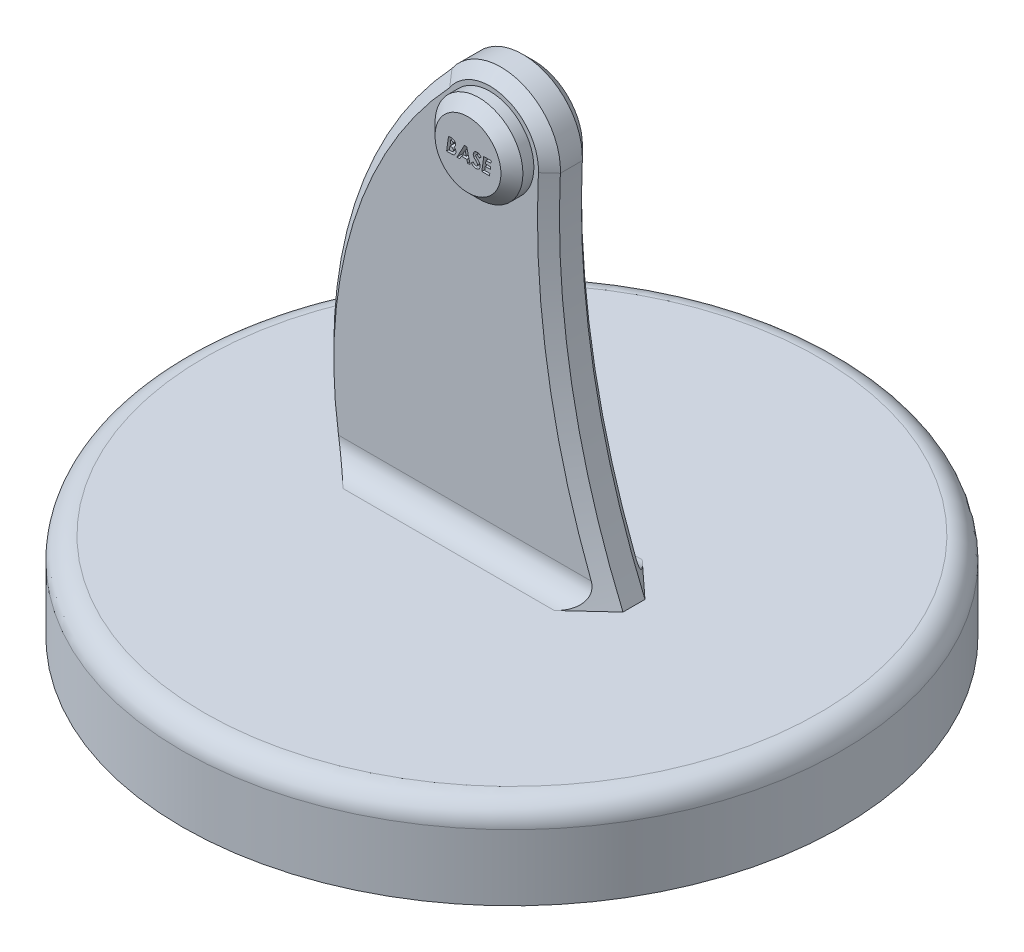
from build123d import *

# Parameters (mm, degrees)
SKETCH1_R           = 75
BOSS_EXTRUDE1_DEPTH = 20
FILLET1_R           = 5
BOSS_EXTRUDE2_DEPTH = 5
CHAMFER1_SIZE       = 2.5
FILLET2_R           = 5
SKETCH3_R           = 10
BOSS_EXTRUDE4_DEPTH = 5
CHAMFER2_SIZE       = 2.5
SKETCH4_R           = 5
CUT_EXTRUDE1_DEPTH  = 10
CUT_EXTRUDE2_DEPTH  = 2.5


with BuildPart() as part:
    # Sketch1 → Boss-Extrude1 (new body)
    with BuildSketch(Plane(origin=(0, 0, 0), x_dir=(1, 0, 0), z_dir=(0, 1, 0))):
        with Locations(Location((0, 0, 0), (0, 0, 270))):
            Circle(SKETCH1_R)
    extrude(amount=BOSS_EXTRUDE1_DEPTH)

    # Fillet1
    fillet1_edges = [part.edges().sort_by_distance(p)[0] for p in [
        (0, 20, -75),
    ]]
    fillet(fillet1_edges, radius=FILLET1_R)

    # Sketch2 → Boss-Extrude2 (add, symmetric)
    with BuildSketch(Plane.XY):
        with BuildLine():
            Line((-35, 15), (30, 15))
            ThreePointArc((30, 15), (16.650621757, 56.17656303), (13.517551249, 99.349460913))
            ThreePointArc((13.517551249, 99.349460913), (4.342920171, 112.817427092), (-11.128856203, 107.700386515))
            ThreePointArc((-11.128856203, 107.700386515), (-34.877004307, 64.392032842), (-35, 15))
        make_face()
    extrude(amount=BOSS_EXTRUDE2_DEPTH, both=True)

    # Chamfer1
    chamfer1_edges = [part.edges().sort_by_distance(p)[0] for p in [
        (-34.206168084, 66.865449042, 5),
    ]]
    chamfer(chamfer1_edges, length=CHAMFER1_SIZE)
    chamfer1_2_edges = [part.edges().sort_by_distance(p)[0] for p in [
        (-34.206168084, 66.865449042, -5),
    ]]
    chamfer(chamfer1_2_edges, length=CHAMFER1_SIZE)
    chamfer1_3_edges = [part.edges().sort_by_distance(p)[0] for p in [
        (4.342920171, 112.817427092, 5),
        (16.146226739, 58.866294053, 5),
    ]]
    chamfer(chamfer1_3_edges, length=CHAMFER1_SIZE - 0.0001)  # a hair under: the kernel refuses the full size
    chamfer1_4_edges = [part.edges().sort_by_distance(p)[0] for p in [
        (16.146226739, 58.866294053, -5),
        (4.342920171, 112.817427092, -5),
    ]]
    chamfer(chamfer1_4_edges, length=CHAMFER1_SIZE - 0.0001)  # a hair under: the kernel refuses the full size

    # Fillet2
    fillet2_edges = [part.edges().sort_by_distance(p)[0] for p in [
        (-4.258213904, 20, -5),
        (-4.258213904, 20, 5),
    ]]
    fillet(fillet2_edges, radius=FILLET2_R)

    # Sketch3 → Boss-Extrude4 (add, symmetric)
    with BuildSketch(Plane.XY.offset(5)):
        with Locations((0, 100)):
            Circle(SKETCH3_R)
    extrude(amount=BOSS_EXTRUDE4_DEPTH, both=True)

    # Chamfer2
    chamfer2_edges = [part.edges().sort_by_distance(p)[0] for p in [
        (-10, 100, 10),
    ]]
    chamfer(chamfer2_edges, length=CHAMFER2_SIZE)

    # Sketch4 → Cut-Extrude1 (cut)
    with BuildSketch(Plane(origin=(0, 0, -5), x_dir=(-1, 0, 0), z_dir=(0, 0, -1))):
        with Locations((0, 100)):
            Circle(SKETCH4_R)
    extrude(amount=-CUT_EXTRUDE1_DEPTH, mode=Mode.SUBTRACT)

    # Sketch5 → Cut-Extrude2 (cut)
    # profile 1 of 4: a face of its own
    with BuildSketch(Plane.XY.offset(10)):
        with BuildLine():
            Line((-4.422917007, 101.448421654), (-3.947175821, 101.448421654))
            add(Edge.make_bspline(
                [(-3.947175821, 101.448421654), (-3.912187022, 101.448314109), (-3.844500379, 101.448106062), (-3.746513184, 101.442654237), (-3.655317716, 101.435046502), (-3.57090309, 101.425566301), (-3.493737475, 101.411226731), (-3.423343143, 101.394935777), (-3.359804192, 101.375644939), (-3.28516824, 101.344965748), (-3.20087624, 101.298193388), (-3.108817155, 101.229869759), (-3.029332764, 101.145607546), (-2.959690254, 101.050994123), (-2.903079777, 100.947362768), (-2.86295903, 100.837570678), (-2.837650581, 100.723872075), (-2.834472541, 100.646533318), (-2.832872936, 100.60760635)],
                knots=[0, 0, 0, 0, 1.060182399, 2.050947427, 2.972933909, 3.833603532, 4.623758792, 5.349968742, 6.022619805, 6.633490032, 7.792338899, 8.934684725, 10.0933911, 11.288487101, 12.487324871, 13.658169267, 14.821284765, 16, 16, 16, 16], degree=3))
            add(Edge.make_bspline(
                [(-2.832872936, 100.60760635), (-2.834061487, 100.574898056), (-2.836414088, 100.510155724), (-2.852577757, 100.414389493), (-2.88032245, 100.321675968), (-2.918146006, 100.232291442), (-2.966597737, 100.148111354), (-3.02494751, 100.070443375), (-3.093240264, 99.999984284), (-3.145075528, 99.959554704), (-3.171234314, 99.939151822)],
                knots=[0, 0, 0, 0, 1.008802286, 1.996808917, 2.985853824, 3.987935791, 4.984003692, 5.974085787, 6.977617699, 8, 8, 8, 8], degree=3))
            add(Edge.make_bspline(
                [(-3.171234314, 99.939151822), (-3.137746271, 99.914256427), (-3.072344036, 99.865635656), (-2.986839677, 99.781511231), (-2.914285714, 99.691887444), (-2.854062269, 99.596364402), (-2.808396679, 99.493802096), (-2.775087675, 99.385602233), (-2.754772417, 99.27124769), (-2.752580946, 99.192975084), (-2.75146268, 99.153034034)],
                knots=[0, 0, 0, 0, 1.076867414, 2.103124847, 3.088410714, 4.050300241, 5.011160291, 5.979497965, 6.968975523, 8, 8, 8, 8], degree=3))
            add(Edge.make_bspline(
                [(-2.75146268, 99.153034034), (-2.753022081, 99.111358505), (-2.75610573, 99.028946918), (-2.78163704, 98.908199391), (-2.824110819, 98.793066125), (-2.882713192, 98.685429847), (-2.952228658, 98.586861786), (-3.03194489, 98.501424114), (-3.118937178, 98.4294262), (-3.198630022, 98.380412809), (-3.268059951, 98.34916751), (-3.325539045, 98.3289474), (-3.388421631, 98.311605401), (-3.456960206, 98.298201306), (-3.530710684, 98.286299685), (-3.609989957, 98.279360824), (-3.694595453, 98.273699026), (-3.752967136, 98.273516055), (-3.783083273, 98.273421654)],
                knots=[0, 0, 0, 0, 1.303747164, 2.57810456, 3.844347155, 5.133141427, 6.403898642, 7.610790585, 8.780141826, 9.92981316, 10.526901919, 11.160883678, 11.835562906, 12.567100275, 13.346228134, 14.173084326, 15.057425816, 16, 16, 16, 16], degree=3))
            Line((-3.783083273, 98.273421654), (-4.868129346, 98.273421654))
            Line((-4.868129346, 98.273421654), (-4.422917007, 101.448421654))
        make_face()
        with BuildLine():
            Line((-4.026042007, 100.18656268), (-3.921735116, 100.18656268))
            add(Edge.make_bspline(
                [(-3.921735116, 100.18656268), (-3.902863091, 100.186646522), (-3.866804712, 100.186806719), (-3.815299626, 100.189042871), (-3.768354898, 100.19103224), (-3.726416644, 100.195785211), (-3.688778539, 100.20058886), (-3.656178629, 100.207107156), (-3.627759333, 100.213413668), (-3.59685583, 100.225919719), (-3.561623527, 100.244541808), (-3.524553228, 100.276312739), (-3.489948085, 100.314526829), (-3.459873099, 100.360342813), (-3.434574978, 100.411290795), (-3.416144779, 100.466041468), (-3.404967425, 100.523625225), (-3.403495142, 100.562822908), (-3.402744731, 100.582801662)],
                knots=[0, 0, 0, 0, 1.199333927, 2.291542006, 3.276678834, 4.184405191, 4.973343612, 5.686872737, 6.298011521, 6.818495195, 7.801417815, 8.815884106, 9.903594398, 11.069613373, 12.286904311, 13.509850177, 14.730790054, 16, 16, 16, 16], degree=3))
            add(Edge.make_bspline(
                [(-3.402744731, 100.582801662), (-3.403340166, 100.601073495), (-3.404504993, 100.636817941), (-3.413979372, 100.68827061), (-3.430208995, 100.735778086), (-3.452362404, 100.778805354), (-3.479417937, 100.816881747), (-3.510924838, 100.848950164), (-3.547254247, 100.873263021), (-3.58106286, 100.88860861), (-3.612118196, 100.8978148), (-3.640930753, 100.903171559), (-3.674868651, 100.908273683), (-3.714101556, 100.912714115), (-3.758662065, 100.915803711), (-3.808513938, 100.917489622), (-3.86363906, 100.918800709), (-3.902229685, 100.919099198), (-3.922371133, 100.919254987)],
                knots=[0, 0, 0, 0, 1.217888189, 2.382505203, 3.473394342, 4.554621668, 5.598222957, 6.577909812, 7.534682879, 8.496456537, 9.042175867, 9.690967717, 10.448749248, 11.330850431, 12.323004962, 13.426554395, 14.656852007, 16, 16, 16, 16], degree=3))
            Line((-3.922371133, 100.919254987), (-4.026042007, 100.18656268))
        make_face(mode=Mode.SUBTRACT)
        with BuildLine():
            Line((-4.218755348, 98.802588321), (-3.851137159, 98.789867968))
            add(Edge.make_bspline(
                [(-3.851137159, 98.789867968), (-3.82886567, 98.79025255), (-3.78574682, 98.790997123), (-3.723315517, 98.796183613), (-3.665435358, 98.8040994), (-3.612339904, 98.815960111), (-3.564491395, 98.832243728), (-3.520696569, 98.850370279), (-3.481590307, 98.87253393), (-3.447577082, 98.899142641), (-3.417838312, 98.928265175), (-3.391758536, 98.959890201), (-3.370428688, 98.994304849), (-3.352132652, 99.031021529), (-3.338488319, 99.070414951), (-3.327934249, 99.112276404), (-3.322454789, 99.156702846), (-3.321712196, 99.187154251), (-3.321334475, 99.202643409)],
                knots=[0, 0, 0, 0, 1.396545255, 2.703789819, 3.925918336, 5.057947269, 6.109009747, 7.09185152, 8.026860065, 8.917724649, 9.79206713, 10.633022212, 11.481406092, 12.325717456, 13.200363125, 14.090334412, 15.028645384, 16, 16, 16, 16], degree=3))
            add(Edge.make_bspline(
                [(-3.321334475, 99.202643409), (-3.322385227, 99.225603265), (-3.32443892, 99.27047827), (-3.338513498, 99.336242471), (-3.363955735, 99.397469361), (-3.397553605, 99.454808895), (-3.439098572, 99.506191038), (-3.488488995, 99.549593109), (-3.544149116, 99.584640288), (-3.596080667, 99.607277932), (-3.643311872, 99.621816482), (-3.686913344, 99.62996578), (-3.737495192, 99.638637122), (-3.795762383, 99.644308599), (-3.861003829, 99.650476727), (-3.933794729, 99.653850498), (-4.013939073, 99.656492633), (-4.069924495, 99.657085936), (-4.099184034, 99.657396013)],
                knots=[0, 0, 0, 0, 1.072622611, 2.096439365, 3.122744367, 4.15723709, 5.19210906, 6.195602288, 7.215049995, 8.252903698, 8.832552919, 9.520188734, 10.322946655, 11.229686895, 12.253743166, 13.384425235, 14.63302787, 16, 16, 16, 16], degree=3))
            Line((-4.099184034, 99.657396013), (-4.218755348, 98.802588321))
        make_face(mode=Mode.SUBTRACT)
    # profile 2 of 4: a face of its own
    with BuildSketch(Plane.XY.offset(10)):
        Polygon((-0.800796614, 101.448421654), (-0.300886758, 101.448421654), (0.504947577, 98.273421654), (-0.081460677, 98.273421654), (-0.257001542, 98.965408834), (-1.494691846, 98.965408834), (-1.866126141, 98.273421654), (-2.507231911, 98.273421654), align=None)
        Polygon((-0.392473297, 99.4945755), (-0.65451256, 100.528104146), (-1.209755949, 99.4945755), align=None, mode=Mode.SUBTRACT)
    # profile 3 of 4: a face of its own
    with BuildSketch(Plane.XY.offset(10)):
        with BuildLine():
            Line((2.986052344, 101.00702542), (2.54465611, 100.622234755))
            add(Edge.make_bspline(
                [(2.54465611, 100.622234755), (2.522596174, 100.652034328), (2.480318712, 100.709144659), (2.413233055, 100.785745003), (2.348962532, 100.852309779), (2.284223563, 100.905392328), (2.2211215, 100.947483717), (2.159106459, 100.977973857), (2.097829847, 100.997241234), (2.056955819, 100.999546286), (2.037114043, 101.000665244)],
                knots=[0, 0, 0, 0, 1.358515141, 2.603569235, 3.730126198, 4.746094498, 5.666493297, 6.504166865, 7.273866877, 8, 8, 8, 8], degree=3))
            add(Edge.make_bspline(
                [(2.037114043, 101.000665244), (2.018371791, 100.999853836), (1.982327943, 100.998293389), (1.930589396, 100.984989609), (1.883565815, 100.963589659), (1.843194187, 100.932631992), (1.809475852, 100.896939083), (1.784439531, 100.856884979), (1.769858702, 100.812736529), (1.767837588, 100.782192359), (1.766806551, 100.766610757)],
                knots=[0, 0, 0, 0, 1.130304997, 2.173727141, 3.204821236, 4.229135679, 5.225705988, 6.15679035, 7.05971714, 8, 8, 8, 8], degree=3))
            add(Edge.make_bspline(
                [(1.766806551, 100.766610757), (1.767745539, 100.751260685), (1.769720516, 100.718974851), (1.78419023, 100.670030016), (1.806077586, 100.618459158), (1.83240339, 100.573618231), (1.861961597, 100.53290127), (1.892936746, 100.493060029), (1.933382068, 100.445424928), (1.982597195, 100.389450583), (2.040111953, 100.324664717), (2.107418087, 100.252009972), (2.183303722, 100.171009183), (2.237203746, 100.114439328), (2.265444372, 100.084799859)],
                knots=[0, 0, 0, 0, 0.642317819, 1.35098826, 2.122816345, 2.986294386, 3.520967692, 4.229638134, 5.099348126, 6.137609051, 7.351336444, 8.727500291, 10.285391505, 12, 12, 12, 12], degree=3))
            add(Edge.make_bspline(
                [(2.265444372, 100.084799859), (2.280764188, 100.06895227), (2.310159938, 100.038543826), (2.35140607, 99.994133289), (2.38821909, 99.952973154), (2.422208163, 99.916504997), (2.451304985, 99.882845849), (2.476148181, 99.852803244), (2.497238554, 99.826799925), (2.509707404, 99.810489557), (2.515399299, 99.80304405)],
                knots=[0, 0, 0, 0, 1.403722598, 2.693470914, 3.859630393, 4.920438112, 5.867965235, 6.69256451, 7.40316977, 8, 8, 8, 8], degree=3))
            add(Edge.make_bspline(
                [(2.515399299, 99.80304405), (2.538064779, 99.771731413), (2.581779732, 99.711338672), (2.638481273, 99.619515986), (2.685379775, 99.531046587), (2.722232557, 99.444883448), (2.749800873, 99.360084156), (2.769767783, 99.275246977), (2.78234535, 99.189666238), (2.783740338, 99.132087207), (2.784434756, 99.103424659)],
                knots=[0, 0, 0, 0, 1.215130546, 2.343624586, 3.390252636, 4.360992906, 5.286454858, 6.190345157, 7.099163061, 8, 8, 8, 8], degree=3))
            add(Edge.make_bspline(
                [(2.784434756, 99.103424659), (2.783570633, 99.071789258), (2.781870036, 99.009530629), (2.768692491, 98.918185522), (2.748167449, 98.830600212), (2.717561496, 98.747300896), (2.679770617, 98.667381134), (2.631805959, 98.592011215), (2.57662879, 98.519915885), (2.512929916, 98.452798365), (2.443210475, 98.3914197), (2.367293713, 98.338267822), (2.287049761, 98.292962892), (2.201662896, 98.255664763), (2.111393313, 98.227296477), (2.01640205, 98.207119046), (1.916864462, 98.19372534), (1.848685898, 98.192590753), (1.813871855, 98.192011398)],
                knots=[0, 0, 0, 0, 1.018989505, 2.005376454, 2.968035412, 3.912365187, 4.859556873, 5.811049809, 6.78527381, 7.780773345, 8.787785161, 9.773320145, 10.761314359, 11.752515283, 12.770107012, 13.804505292, 14.878913802, 16, 16, 16, 16], degree=3))
            add(Edge.make_bspline(
                [(1.813871855, 98.192011398), (1.787144997, 98.192546923), (1.734236698, 98.193607045), (1.655816914, 98.200645727), (1.57929853, 98.212661672), (1.504793992, 98.230001572), (1.432147734, 98.251652902), (1.361246498, 98.277641611), (1.292267691, 98.309097913), (1.225122974, 98.345203851), (1.159806139, 98.386100633), (1.096709112, 98.432276078), (1.035151119, 98.482839736), (0.975938986, 98.538749242), (0.917822537, 98.598461297), (0.861819674, 98.663334285), (0.808493126, 98.733640103), (0.774641367, 98.78273766), (0.757446575, 98.807676462)],
                knots=[0, 0, 0, 0, 1.003438088, 1.986398949, 2.953471805, 3.909242729, 4.856156023, 5.798037682, 6.742035895, 7.700024963, 8.658509928, 9.632892881, 10.633707184, 11.647385023, 12.688779161, 13.761077638, 14.862753205, 16, 16, 16, 16], degree=3))
            Line((0.757446575, 98.807676462), (1.227463602, 99.177202704))
            add(Edge.make_bspline(
                [(1.227463602, 99.177202704), (1.250874454, 99.141205511), (1.295774978, 99.072165183), (1.368960762, 98.978972975), (1.443573363, 98.899769992), (1.519883697, 98.834864188), (1.598137271, 98.784362478), (1.677772355, 98.74826345), (1.759143367, 98.725044611), (1.814359069, 98.722463476), (1.841856631, 98.721178064)],
                knots=[0, 0, 0, 0, 1.289844872, 2.473840458, 3.555310637, 4.554525788, 5.477014656, 6.343795492, 7.175205895, 8, 8, 8, 8], degree=3))
            add(Edge.make_bspline(
                [(1.841856631, 98.721178064), (1.867227872, 98.722289967), (1.916617793, 98.724454495), (1.987269844, 98.744607747), (2.052090423, 98.77567529), (2.108208141, 98.820034862), (2.155483387, 98.872132216), (2.189848267, 98.931482257), (2.210536767, 98.996510504), (2.213200741, 99.041580893), (2.214562961, 99.064627584)],
                knots=[0, 0, 0, 0, 1.07813582, 2.098795369, 3.104167493, 4.120866408, 5.124778177, 6.083335831, 7.019916046, 8, 8, 8, 8], degree=3))
            add(Edge.make_bspline(
                [(2.214562961, 99.064627584), (2.213912195, 99.08335994), (2.212588417, 99.121465008), (2.198789294, 99.178218332), (2.178309113, 99.235765946), (2.153486533, 99.284402377), (2.12671377, 99.327050128), (2.09836115, 99.365670688), (2.062685425, 99.41100219), (2.018549538, 99.461980621), (1.967757636, 99.520327013), (1.908385209, 99.583990802), (1.842329238, 99.655078812), (1.79490047, 99.703716921), (1.769986639, 99.729266005)],
                knots=[0, 0, 0, 0, 0.82235112, 1.672813781, 2.554588539, 3.50524042, 4.06657461, 4.767804758, 5.610876414, 6.602916144, 7.732569792, 9.01260869, 10.430754915, 12, 12, 12, 12], degree=3))
            add(Edge.make_bspline(
                [(1.769986639, 99.729266005), (1.743617876, 99.756538312), (1.69264284, 99.809260042), (1.620526815, 99.886417944), (1.555567419, 99.958232338), (1.497838204, 100.02477879), (1.447291484, 100.086176924), (1.403052625, 100.14196096), (1.366460604, 100.192866773), (1.345822931, 100.225895679), (1.336222617, 100.241260196)],
                knots=[0, 0, 0, 0, 1.354401886, 2.618275412, 3.770529779, 4.811580489, 5.763301005, 6.60974666, 7.35327647, 8, 8, 8, 8], degree=3))
            add(Edge.make_bspline(
                [(1.336222617, 100.241260196), (1.314786945, 100.279546239), (1.27319804, 100.353827774), (1.230322963, 100.470739959), (1.202382957, 100.586150131), (1.198730505, 100.663212697), (1.196934756, 100.701100941)],
                knots=[0, 0, 0, 0, 1.081804801, 2.098888081, 3.065307629, 4, 4, 4, 4], degree=3))
            add(Edge.make_bspline(
                [(1.196934756, 100.701100941), (1.19757955, 100.725510932), (1.198862165, 100.774066964), (1.208096005, 100.845729278), (1.222234437, 100.915804055), (1.244773429, 100.98322838), (1.270767388, 101.049690562), (1.30474472, 101.11344424), (1.342918376, 101.176204593), (1.373543923, 101.21508318), (1.38901208, 101.234719731)],
                knots=[0, 0, 0, 0, 1.012167245, 2.013389743, 2.992947912, 3.971795425, 4.958040075, 5.949133471, 6.964161297, 8, 8, 8, 8], degree=3))
            add(Edge.make_bspline(
                [(1.38901208, 101.234719731), (1.409431387, 101.258385559), (1.44970562, 101.305063099), (1.519387689, 101.364730262), (1.593270058, 101.416269117), (1.672943084, 101.457644429), (1.757490597, 101.490621034), (1.847716705, 101.512997869), (1.942929928, 101.52761656), (2.008224884, 101.529083072), (2.041566166, 101.529831911)],
                knots=[0, 0, 0, 0, 1.010152455, 1.992384693, 2.959065588, 3.919519142, 4.890305168, 5.888624478, 6.921877408, 8, 8, 8, 8], degree=3))
            add(Edge.make_bspline(
                [(2.041566166, 101.529831911), (2.087672057, 101.528222286), (2.178622672, 101.525047065), (2.312424524, 101.50036775), (2.439929882, 101.458534203), (2.562413946, 101.401696539), (2.677887968, 101.32684462), (2.787894142, 101.236362445), (2.892371764, 101.12960508), (2.954243681, 101.048646588), (2.986052344, 101.00702542)],
                knots=[0, 0, 0, 0, 0.984438778, 1.941949542, 2.894274057, 3.844399604, 4.817935388, 5.825099055, 6.88187249, 8, 8, 8, 8], degree=3))
        make_face()
    # profile 4 of 4: a face of its own
    with BuildSketch(Plane.XY.offset(10)):
        Polygon((3.59599325, 101.448421654), (5.308152705, 101.448421654), (5.241370854, 100.919254987), (4.097175141, 100.919254987), (3.994140285, 100.18656268), (5.149148298, 100.18656268), (5.081730429, 99.657396013), (3.919726222, 99.657396013), (3.800154908, 98.802588321), (4.97424345, 98.802588321), (4.907461599, 98.273421654), (3.15078091, 98.273421654), align=None)
    extrude(amount=-CUT_EXTRUDE2_DEPTH, mode=Mode.SUBTRACT)


solid = part.part
